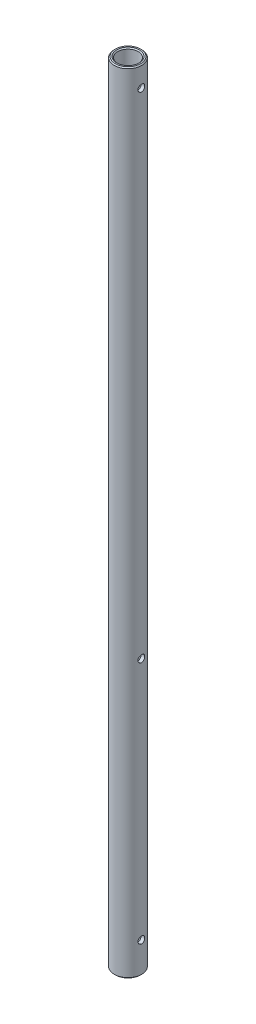
from build123d import *

# Parameters (mm, degrees)
SKETCH_1_R               = 4
SKETCH_1_R_2             = 3
EXTRUDE_1_DEPTH          = 230
CHAMFER_1_SIZE           = 0.3
CUT_EXTRUDE_1_DEPTH      = 231.0695547
CUT_EXTRUDE_1_DEPTH_BACK = 231.0695547
SKETCH_2_R               = 1
CUT_EXTRUDE_2_DEPTH      = 231.069554704
CUT_EXTRUDE_2_DEPTH_BACK = 231.069554704
SKETCH_3_R               = 1
CUT_EXTRUDE_3_DEPTH      = 231.069554704
CUT_EXTRUDE_3_DEPTH_BACK = 231.069554704
SKETCH_4_R               = 1


with BuildPart() as part:
    # Эскиз1 → Бобышка-Вытянуть1 (new body)
    with BuildSketch(Plane(origin=(0, 0, 0), x_dir=(1, 0, 0), z_dir=(0, 1, 0))):
        Circle(SKETCH_1_R)
        Circle(SKETCH_1_R_2, mode=Mode.SUBTRACT)
    extrude(amount=EXTRUDE_1_DEPTH)

    # Фаска1
    chamfer_1_edges = [part.edges().sort_by_distance(p)[0] for p in [
        (-3, 230, 0),
        (-3, 0, 0),
        (-4, 0, 0),
        (-4, 230, 0),
    ]]
    chamfer(chamfer_1_edges, length=CHAMFER_1_SIZE)

    # Эскиз2 → Вырез-Вытянуть1 (cut, two sides: drawn at the far end of the back side and taken through both)
    with BuildSketch(Plane(origin=(0, 0, 0), x_dir=(0, 0, -1), z_dir=(1, 0, 0)).offset(-CUT_EXTRUDE_1_DEPTH_BACK)):
        with Locations((0, 9)):
            Circle(SKETCH_2_R)
    extrude(amount=CUT_EXTRUDE_1_DEPTH + CUT_EXTRUDE_1_DEPTH_BACK, mode=Mode.SUBTRACT)

    # Эскиз3 → Вырез-Вытянуть2 (cut, two sides: drawn at the far end of the back side and taken through both)
    with BuildSketch(Plane(origin=(0, 0, 0), x_dir=(0, 0, -1), z_dir=(1, 0, 0)).offset(-CUT_EXTRUDE_2_DEPTH_BACK)):
        with Locations((0, 80)):
            Circle(SKETCH_3_R)
    extrude(amount=CUT_EXTRUDE_2_DEPTH + CUT_EXTRUDE_2_DEPTH_BACK, mode=Mode.SUBTRACT)

    # Эскиз4 → Вырез-Вытянуть3 (cut, two sides: drawn at the far end of the back side and taken through both)
    with BuildSketch(Plane(origin=(0, 0, 0), x_dir=(0, 0, -1), z_dir=(1, 0, 0)).offset(-CUT_EXTRUDE_3_DEPTH_BACK)):
        with Locations((0, 224)):
            Circle(SKETCH_4_R)
    extrude(amount=CUT_EXTRUDE_3_DEPTH + CUT_EXTRUDE_3_DEPTH_BACK, mode=Mode.SUBTRACT)


solid = part.part
